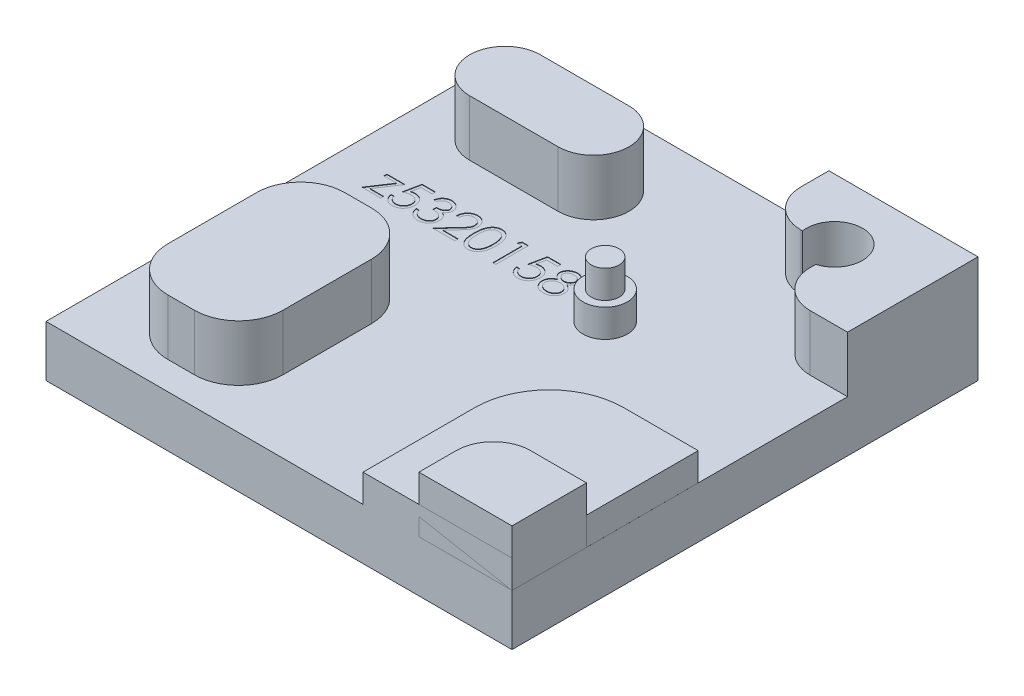
from build123d import *

# Parameters (mm, degrees)
SKETCH1_W            = 50
SKETCH1_H            = 50
BOSS_EXTRUDE4_DEPTH  = 5.5
BOSS_EXTRUDE27_DEPTH = 6
SKETCH10_R           = 2.375
BOSS_EXTRUDE29_DEPTH = 3
CUT_EXTRUDE1_DEPTH   = 0.05
BOSS_EXTRUDE31_DEPTH = 6
BOSS_EXTRUDE32_DEPTH = 6
BOSS_EXTRUDE38_DEPTH = 3
BOSS_EXTRUDE39_DEPTH = 6
SKETCH12_R           = 1.4985
BOSS_EXTRUDE40_DEPTH = 3


with BuildPart() as part:
    # Sketch1 → Boss-Extrude4 (new body)
    with BuildSketch(Plane(origin=(0, 0, 0), x_dir=(1, 0, 0), z_dir=(0, 1, 0))):
        with Locations((2.35426009, -4.035874439)):
            Rectangle(SKETCH1_W, SKETCH1_H)
    extrude(amount=BOSS_EXTRUDE4_DEPTH)

    # Sketch8 → Boss-Extrude27 (add)
    with BuildSketch(Plane(origin=(0, 5.5, 0), x_dir=(1, 0, 0), z_dir=(0, 1, 0))):
        with BuildLine():
            ThreePointArc((11.35426009, 17.964125561), (12.525832965, 15.135698436), (15.35426009, 13.964125561))
            Line((15.35426009, 13.964125561), (15.533330738, 13.964125561))
            ThreePointArc((15.533330738, 13.964125561), (20.09656079, 16.968446906), (19.35426009, 11.555683755))
            Line((19.35426009, 11.555683755), (19.35426009, 10.964125561))
            ThreePointArc((19.35426009, 10.964125561), (20.525832965, 8.135698436), (23.35426009, 6.964125561))
            Line((23.35426009, 6.964125561), (27.35426009, 6.964125561))
            Line((27.35426009, 6.964125561), (27.35426009, 20.964125561))
            Line((27.35426009, 20.964125561), (11.35426009, 20.964125561))
            Line((11.35426009, 20.964125561), (11.35426009, 17.964125561))
        make_face()
    extrude(amount=BOSS_EXTRUDE27_DEPTH)

    # Sketch13 → Cut-Extrude1 (cut)
    # profile 1 of 8: a face of its own
    with BuildSketch(Plane(origin=(0, 5.5, 0), x_dir=(1, 0, 0), z_dir=(0, 1, 0))):
        Polygon((-18.036064921, 2.940033073), (-16.106577742, 2.940033073), (-17.59435819, 0.696443329), (-16.151449537, 0.696443329), (-16.151449537, 0.382340765), (-18.170680306, 0.382340765), (-16.682198735, 2.625930509), (-18.036064921, 2.625930509), align=None)
    # profile 2 of 8: a face of its own
    with BuildSketch(Plane(origin=(0, 5.5, 0), x_dir=(1, 0, 0), z_dir=(0, 1, 0))):
        with BuildLine():
            Line((-13.773244408, 3.882340765), (-13.773244408, 3.523366406))
            Line((-13.773244408, 3.523366406), (-14.963749216, 3.523366406))
            Line((-14.963749216, 3.523366406), (-15.152350979, 2.60279349))
            add(Edge.make_bspline(
                [(-15.152350979, 2.60279349), (-15.115295104, 2.613023761), (-15.043505209, 2.632843295), (-14.937545348, 2.654849065), (-14.836953144, 2.66811451), (-14.771677774, 2.66992582), (-14.740091363, 2.670802304)],
                knots=[0, 0, 0, 0, 1.100273476, 2.13160584, 3.095893838, 4, 4, 4, 4], degree=3))
            add(Edge.make_bspline(
                [(-14.740091363, 2.670802304), (-14.701007624, 2.669956368), (-14.624159226, 2.668293047), (-14.511720279, 2.652321198), (-14.404387386, 2.627181283), (-14.302385016, 2.592060761), (-14.205524465, 2.547151028), (-14.114696904, 2.491051088), (-14.028538991, 2.425517757), (-13.948596397, 2.350172745), (-13.876072089, 2.267251128), (-13.812306099, 2.178093257), (-13.758143509, 2.083565595), (-13.714582754, 1.982764986), (-13.67979842, 1.876805833), (-13.656646425, 1.76457325), (-13.641229716, 1.64712513), (-13.63950733, 1.56682056), (-13.638629024, 1.525870413)],
                knots=[0, 0, 0, 0, 1.052922333, 2.070308379, 3.05430497, 4.020497103, 4.973039431, 5.925935799, 6.892292201, 7.88610001, 8.88166317, 9.857072816, 10.836096531, 11.812156883, 12.81219415, 13.836441305, 14.89672472, 16, 16, 16, 16], degree=3))
            add(Edge.make_bspline(
                [(-13.638629024, 1.525870413), (-13.639294099, 1.497348192), (-13.640615262, 1.440689205), (-13.647333849, 1.356545004), (-13.660269565, 1.274182171), (-13.677637289, 1.193589779), (-13.700179707, 1.114920407), (-13.727468761, 1.037948879), (-13.760864789, 0.963154272), (-13.797496164, 0.889828877), (-13.838742642, 0.81963037), (-13.884521149, 0.753981384), (-13.932886641, 0.691897102), (-13.984928026, 0.634043369), (-14.041129021, 0.580800351), (-14.100808988, 0.53185207), (-14.163491707, 0.486370739), (-14.230146949, 0.446202544), (-14.299289432, 0.409239588), (-14.37191765, 0.378916051), (-14.44637835, 0.351805523), (-14.523743226, 0.330195995), (-14.603837038, 0.31326344), (-14.686791814, 0.30176284), (-14.772172484, 0.293386402), (-14.830047496, 0.292862045), (-14.859282069, 0.292597176)],
                knots=[0, 0, 0, 0, 1.056347294, 2.098418968, 3.122841568, 4.141288669, 5.149314143, 6.15115421, 7.162517403, 8.180376062, 9.185164535, 10.17417709, 11.141909838, 12.097768115, 13.052685741, 14.0056014, 14.954263652, 15.917497458, 16.885230207, 17.854509472, 18.828990115, 19.81800267, 20.826176721, 21.857883937, 22.917946725, 24, 24, 24, 24], degree=3))
            add(Edge.make_bspline(
                [(-14.859282069, 0.292597176), (-14.894156249, 0.293288014), (-14.96276708, 0.294647156), (-15.063287647, 0.308865641), (-15.160002253, 0.329229557), (-15.252132354, 0.359865827), (-15.340503618, 0.398253122), (-15.423926335, 0.446769293), (-15.504532111, 0.501748397), (-15.579044148, 0.56662875), (-15.648200262, 0.637544432), (-15.710106771, 0.714502073), (-15.765240347, 0.796231515), (-15.812718094, 0.883129669), (-15.853216116, 0.9749682), (-15.885031104, 1.072091201), (-15.910709459, 1.173991205), (-15.921572879, 1.244144716), (-15.927090562, 1.279776663)],
                knots=[0, 0, 0, 0, 1.0467383, 2.05933395, 3.04377827, 4.011590433, 4.970194871, 5.932262533, 6.905835911, 7.896367577, 8.894135286, 9.877477877, 10.858688626, 11.851381753, 12.8477658, 13.868841284, 14.917554742, 16, 16, 16, 16], degree=3))
            Line((-15.927090562, 1.279776663), (-15.612987998, 1.279776663))
            add(Edge.make_bspline(
                [(-15.612987998, 1.279776663), (-15.605259441, 1.24640021), (-15.590404724, 1.182248815), (-15.557798975, 1.092117474), (-15.5179331, 1.01179825), (-15.470528752, 0.940228667), (-15.413978721, 0.87781967), (-15.349449292, 0.822202608), (-15.277101569, 0.772027479), (-15.196708339, 0.730204711), (-15.11189526, 0.694535958), (-15.02312805, 0.670784263), (-14.932823704, 0.65408337), (-14.871745333, 0.652411609), (-14.841052902, 0.651571535)],
                knots=[0, 0, 0, 0, 1.136247022, 2.183929868, 3.172523383, 4.106158343, 5.02341133, 5.958108904, 6.928429099, 7.938127109, 8.96079061, 9.975095812, 10.982467395, 12, 12, 12, 12], degree=3))
            add(Edge.make_bspline(
                [(-14.841052902, 0.651571535), (-14.811094458, 0.652392312), (-14.752106035, 0.654008431), (-14.665294649, 0.666447443), (-14.581481774, 0.685605014), (-14.501494418, 0.714274869), (-14.423932878, 0.749119588), (-14.350759108, 0.793834663), (-14.279856231, 0.845294682), (-14.213428097, 0.904251312), (-14.152588648, 0.969221007), (-14.098832527, 1.0386984), (-14.054055613, 1.112815247), (-14.016321504, 1.190288399), (-13.987668205, 1.271966957), (-13.967227224, 1.357468132), (-13.955224165, 1.447003112), (-13.953572985, 1.508072422), (-13.952731588, 1.539191727)],
                knots=[0, 0, 0, 0, 1.027316725, 2.022795036, 3.002884548, 3.971462791, 4.93288096, 5.914575861, 6.907176829, 7.935150275, 8.956128384, 9.956726525, 10.942570165, 11.921478529, 12.907843606, 13.90538589, 14.932640048, 16, 16, 16, 16], degree=3))
            add(Edge.make_bspline(
                [(-13.952731588, 1.539191727), (-13.953390067, 1.567267478), (-13.954678947, 1.622221767), (-13.965209517, 1.702620974), (-13.98352649, 1.778694016), (-14.00895037, 1.85080825), (-14.041229877, 1.919031693), (-14.08067619, 1.983434753), (-14.128029588, 2.043168586), (-14.182121476, 2.09826114), (-14.241379517, 2.149106014), (-14.30682326, 2.192450101), (-14.377083187, 2.228914019), (-14.451312786, 2.260382017), (-14.531277685, 2.282982762), (-14.615394317, 2.299950648), (-14.704571025, 2.30976601), (-14.765541713, 2.311127899), (-14.796882229, 2.311827945)],
                knots=[0, 0, 0, 0, 1.045622112, 2.046656509, 3.013763289, 3.955457236, 4.890082067, 5.820317437, 6.762574623, 7.722996705, 8.69280354, 9.665887285, 10.63943826, 11.638615906, 12.663482002, 13.728887084, 14.832589034, 16, 16, 16, 16], degree=3))
            add(Edge.make_bspline(
                [(-14.796882229, 2.311827945), (-14.824011158, 2.311247354), (-14.880025513, 2.31004858), (-14.96594834, 2.301222083), (-15.056240063, 2.286982789), (-15.150554558, 2.267396541), (-15.249175066, 2.241765465), (-15.351893467, 2.211050964), (-15.458925734, 2.174328965), (-15.531043458, 2.146596752), (-15.568116203, 2.132340765)],
                knots=[0, 0, 0, 0, 0.817624296, 1.688186739, 2.600797293, 3.572016777, 4.590301741, 5.671205678, 6.80286297, 8, 8, 8, 8], degree=3))
            Line((-15.568116203, 2.132340765), (-15.209141844, 3.882340765))
            Line((-15.209141844, 3.882340765), (-13.773244408, 3.882340765))
        make_face()
    # profile 3 of 8: a face of its own
    with BuildSketch(Plane(origin=(0, 5.5, 0), x_dir=(1, 0, 0), z_dir=(0, 1, 0))):
        with BuildLine():
            Line((-12.830936716, 3.074648458), (-13.14503928, 3.074648458))
            add(Edge.make_bspline(
                [(-13.14503928, 3.074648458), (-13.136529729, 3.109880942), (-13.119894254, 3.178757566), (-13.08519668, 3.277164827), (-13.047397425, 3.370288348), (-13.002008321, 3.456384422), (-12.952499566, 3.537183325), (-12.895776845, 3.610852449), (-12.834457122, 3.679265415), (-12.766632173, 3.739978652), (-12.695503511, 3.794956381), (-12.620068892, 3.841831439), (-12.541845998, 3.882155592), (-12.460292865, 3.915375823), (-12.375166693, 3.940401347), (-12.28723707, 3.958558153), (-12.19627357, 3.970349267), (-12.134525979, 3.97150003), (-12.103172293, 3.972084355)],
                knots=[0, 0, 0, 0, 1.162005537, 2.271625781, 3.343758855, 4.383309926, 5.390229558, 6.379919256, 7.361854164, 8.333198761, 9.295911338, 10.242430842, 11.177959212, 12.116337295, 13.062827104, 14.020064771, 14.994644689, 16, 16, 16, 16], degree=3))
            add(Edge.make_bspline(
                [(-12.103172293, 3.972084355), (-12.057489551, 3.970705125), (-11.96712054, 3.967976749), (-11.834357493, 3.943062313), (-11.706330674, 3.90363718), (-11.584441426, 3.849163453), (-11.471222993, 3.78197614), (-11.370486807, 3.702011403), (-11.283598296, 3.610812102), (-11.210703918, 3.510079537), (-11.153628919, 3.402424028), (-11.111542546, 3.291623871), (-11.085920865, 3.1779419), (-11.082600308, 3.10118462), (-11.080936716, 3.062729387)],
                knots=[0, 0, 0, 0, 1.083050992, 2.142477498, 3.193116406, 4.255571735, 5.30263384, 6.308962982, 7.297363603, 8.282367274, 9.249857812, 10.179914175, 11.08814088, 12, 12, 12, 12], degree=3))
            add(Edge.make_bspline(
                [(-11.080936716, 3.062729387), (-11.082100307, 3.025722592), (-11.084377274, 2.953306038), (-11.10371098, 2.847584541), (-11.136247243, 2.74794294), (-11.181317005, 2.653961778), (-11.239658555, 2.566236939), (-11.310331252, 2.484571048), (-11.393833914, 2.40860189), (-11.457112852, 2.365082417), (-11.489690722, 2.342677304)],
                knots=[0, 0, 0, 0, 1.024540389, 2.004866551, 2.965041327, 3.920577974, 4.882998113, 5.874504559, 6.905732034, 8, 8, 8, 8], degree=3))
            add(Edge.make_bspline(
                [(-11.489690722, 2.342677304), (-11.452458968, 2.324699132), (-11.378692094, 2.289079175), (-11.278141564, 2.219223417), (-11.186863689, 2.13856707), (-11.13595997, 2.075624417), (-11.110383831, 2.043999419)],
                knots=[0, 0, 0, 0, 1.015518401, 2.012035669, 3.001164323, 4, 4, 4, 4], degree=3))
            add(Edge.make_bspline(
                [(-11.110383831, 2.043999419), (-11.093542489, 2.020941668), (-11.060135593, 1.975203751), (-11.018900059, 1.901667325), (-10.981490945, 1.827315836), (-10.952340726, 1.75015643), (-10.929766859, 1.671083416), (-10.913630827, 1.58996102), (-10.903606686, 1.506722998), (-10.902171134, 1.450410517), (-10.901449537, 1.422104387)],
                knots=[0, 0, 0, 0, 1.025084078, 2.033381695, 3.024893161, 4.013698104, 4.991890475, 5.976764909, 6.982997093, 8, 8, 8, 8], degree=3))
            add(Edge.make_bspline(
                [(-10.901449537, 1.422104387), (-10.90324405, 1.373094666), (-10.906824632, 1.275305864), (-10.938828706, 1.130831142), (-10.988441947, 0.98960564), (-11.058898883, 0.854530801), (-11.144766392, 0.72815042), (-11.246923716, 0.615074111), (-11.364210124, 0.517875507), (-11.495015773, 0.436665278), (-11.636732902, 0.371747356), (-11.788308494, 0.326689913), (-11.947558548, 0.297343914), (-12.056765845, 0.294197045), (-12.112286876, 0.292597176)],
                knots=[0, 0, 0, 0, 0.955779014, 1.907060117, 2.875433937, 3.871313158, 4.872415639, 5.851225146, 6.836215519, 7.83643374, 8.849228613, 9.86973379, 10.916971861, 12, 12, 12, 12], degree=3))
            add(Edge.make_bspline(
                [(-12.112286876, 0.292597176), (-12.149706177, 0.293465389), (-12.223334882, 0.295173743), (-12.33157838, 0.306852344), (-12.434900079, 0.328182349), (-12.533439677, 0.356885655), (-12.627284714, 0.393277397), (-12.716148819, 0.438596095), (-12.800578712, 0.491907597), (-12.879777663, 0.553841185), (-12.953736231, 0.623122524), (-13.020488955, 0.700981534), (-13.081148748, 0.785978938), (-13.134091387, 0.879101995), (-13.18172834, 0.979147252), (-13.220909296, 1.08739575), (-13.255394865, 1.202879772), (-13.271428329, 1.283357512), (-13.279654665, 1.324648458)],
                knots=[0, 0, 0, 0, 1.048658725, 2.063410685, 3.046034179, 4.001477787, 4.936774919, 5.862367409, 6.792675028, 7.730719943, 8.675894397, 9.627829632, 10.600096036, 11.597688215, 12.626045268, 13.701542398, 14.82072376, 16, 16, 16, 16], degree=3))
            Line((-13.279654665, 1.324648458), (-12.965552101, 1.324648458))
            add(Edge.make_bspline(
                [(-12.965552101, 1.324648458), (-12.957368809, 1.297699444), (-12.941451597, 1.245281273), (-12.914357299, 1.169840967), (-12.883489026, 1.100682914), (-12.850374468, 1.037299792), (-12.815596022, 0.979067389), (-12.776681097, 0.92752552), (-12.736511951, 0.880410318), (-12.706232598, 0.853865706), (-12.691413479, 0.840874419)],
                knots=[0, 0, 0, 0, 1.198163088, 2.33053128, 3.407730985, 4.417276592, 5.372219308, 6.28897303, 7.162600585, 8, 8, 8, 8], degree=3))
            add(Edge.make_bspline(
                [(-12.691413479, 0.840874419), (-12.671816902, 0.825766085), (-12.632684239, 0.795596053), (-12.568916008, 0.757094425), (-12.501851122, 0.7237334), (-12.430036448, 0.698249704), (-12.355021678, 0.676672043), (-12.275594312, 0.662551524), (-12.192455095, 0.652863353), (-12.135687332, 0.652008421), (-12.106677902, 0.651571535)],
                knots=[0, 0, 0, 0, 0.946170439, 1.889420265, 2.845303464, 3.807233317, 4.801018734, 5.828864929, 6.890507805, 8, 8, 8, 8], degree=3))
            add(Edge.make_bspline(
                [(-12.106677902, 0.651571535), (-12.073924399, 0.65218744), (-12.009877752, 0.653391789), (-11.916422893, 0.664467496), (-11.827515445, 0.68059791), (-11.74414252, 0.705510892), (-11.665212012, 0.736291744), (-11.591830363, 0.774940149), (-11.523034257, 0.820284871), (-11.459704851, 0.87182403), (-11.402759344, 0.928245525), (-11.35261983, 0.987258596), (-11.309995169, 1.048614425), (-11.275611591, 1.112652546), (-11.24846104, 1.179107775), (-11.22997784, 1.248166604), (-11.217126325, 1.319263871), (-11.216079713, 1.36759284), (-11.215552101, 1.39195615)],
                knots=[0, 0, 0, 0, 1.217147791, 2.380027433, 3.494444702, 4.572153297, 5.609568379, 6.639424714, 7.649109417, 8.668170816, 9.669597737, 10.625200337, 11.543417969, 12.441394052, 13.322311151, 14.205496177, 15.095365482, 16, 16, 16, 16], degree=3))
            add(Edge.make_bspline(
                [(-11.215552101, 1.39195615), (-11.217082402, 1.424567489), (-11.220135391, 1.489627897), (-11.24344397, 1.585345471), (-11.281782834, 1.677568884), (-11.335455346, 1.764724674), (-11.400791074, 1.845500575), (-11.477155981, 1.917572058), (-11.565184209, 1.977042149), (-11.646204079, 2.018130805), (-11.717969235, 2.04616788), (-11.779384619, 2.064842845), (-11.848141223, 2.080656501), (-11.923407572, 2.095368772), (-12.005750788, 2.10789012), (-12.095081226, 2.118331936), (-12.191416988, 2.126686977), (-12.258108154, 2.130418072), (-12.292475178, 2.132340765)],
                knots=[0, 0, 0, 0, 1.07054697, 2.135767047, 3.216561865, 4.33974944, 5.486079747, 6.621378074, 7.775625952, 8.963672916, 9.598146892, 10.304877434, 11.070270905, 11.915000392, 12.823868403, 13.805723172, 14.86925407, 16, 16, 16, 16], degree=3))
            Line((-12.292475178, 2.132340765), (-12.292475178, 2.491315124))
            add(Edge.make_bspline(
                [(-12.292475178, 2.491315124), (-12.249174012, 2.492049928), (-12.164357665, 2.493489228), (-12.040463361, 2.510897238), (-11.921990048, 2.534977866), (-11.811563306, 2.571863059), (-11.710914593, 2.614703356), (-11.623594991, 2.664555565), (-11.550827844, 2.719970314), (-11.492966772, 2.781802924), (-11.449437544, 2.848117971), (-11.417610746, 2.917234629), (-11.39881042, 2.98975869), (-11.396300753, 3.039253358), (-11.39503928, 3.064131631)],
                knots=[0, 0, 0, 0, 1.321986639, 2.589447074, 3.816329219, 5.01088745, 6.139805852, 7.153945165, 8.075214402, 8.924034688, 9.728124013, 10.488707548, 11.240355623, 12, 12, 12, 12], degree=3))
            add(Edge.make_bspline(
                [(-11.39503928, 3.064131631), (-11.395453691, 3.082409376), (-11.396278142, 3.118772083), (-11.40667542, 3.171897152), (-11.422299461, 3.223398098), (-11.44377919, 3.273055908), (-11.472529389, 3.320526182), (-11.506935375, 3.366213631), (-11.547903476, 3.40985741), (-11.594848923, 3.450537729), (-11.645260728, 3.489306966), (-11.700510503, 3.522220603), (-11.758932377, 3.550365665), (-11.820591032, 3.573575167), (-11.885686563, 3.591034456), (-11.95391312, 3.603570297), (-12.025400804, 3.611407952), (-12.074172536, 3.612536368), (-12.098965562, 3.613109996)],
                knots=[0, 0, 0, 0, 0.884392785, 1.759457502, 2.611959086, 3.489218968, 4.37281399, 5.2945488, 6.255912374, 7.266815255, 8.301784654, 9.332968512, 10.37626691, 11.440494194, 12.520033166, 13.637162961, 14.798855837, 16, 16, 16, 16], degree=3))
            add(Edge.make_bspline(
                [(-12.098965562, 3.613109996), (-12.13881723, 3.611718634), (-12.216656807, 3.60900098), (-12.328871723, 3.585197967), (-12.433191057, 3.547219883), (-12.512929724, 3.501886864), (-12.571812298, 3.45713643), (-12.613889236, 3.418054044), (-12.655209747, 3.37462122), (-12.693055424, 3.324162845), (-12.7313294, 3.270096055), (-12.766173962, 3.209672373), (-12.800033654, 3.144467979), (-12.820436204, 3.098372344), (-12.830936716, 3.074648458)],
                knots=[0, 0, 0, 0, 1.472543308, 2.876219568, 4.221790263, 5.565193594, 6.249813518, 6.953379497, 7.687249741, 8.463570142, 9.283606569, 10.136032583, 11.040678096, 12, 12, 12, 12], degree=3))
        make_face()
    # profile 4 of 8: a face of its own
    with BuildSketch(Plane(origin=(0, 5.5, 0), x_dir=(1, 0, 0), z_dir=(0, 1, 0))):
        with BuildLine():
            Line((-10.138629024, 2.805417688), (-10.452731588, 2.805417688))
            add(Edge.make_bspline(
                [(-10.452731588, 2.805417688), (-10.450684435, 2.847088576), (-10.446663881, 2.928929091), (-10.427835592, 3.048252997), (-10.400894714, 3.162307796), (-10.36280326, 3.27017771), (-10.315496983, 3.372816517), (-10.258766955, 3.469816533), (-10.191573105, 3.560807721), (-10.115366371, 3.644946565), (-10.032597732, 3.722134136), (-9.943291792, 3.788789378), (-9.849446765, 3.84510705), (-9.751347366, 3.892188292), (-9.647886802, 3.927528137), (-9.540003944, 3.953749777), (-9.427224808, 3.969526123), (-9.350384786, 3.971221908), (-9.311305306, 3.972084355)],
                knots=[0, 0, 0, 0, 1.10065271, 2.161652631, 3.183658789, 4.190468796, 5.17591951, 6.163126047, 7.15150782, 8.156236427, 9.156009102, 10.134482811, 11.092018607, 12.041330605, 13.001268258, 13.972401359, 14.968799086, 16, 16, 16, 16], degree=3))
            add(Edge.make_bspline(
                [(-9.311305306, 3.972084355), (-9.272927232, 3.971185899), (-9.197515687, 3.969420464), (-9.087453673, 3.954259434), (-8.982676378, 3.930513843), (-8.883388612, 3.897198427), (-8.790382547, 3.852413999), (-8.702959502, 3.79861646), (-8.620078692, 3.736396629), (-8.545471908, 3.663142816), (-8.476963829, 3.584940431), (-8.417861574, 3.501452528), (-8.36724841, 3.415223242), (-8.32506073, 3.32559504), (-8.294004591, 3.231724012), (-8.270426383, 3.134976809), (-8.25709897, 3.034351998), (-8.255053546, 2.966245442), (-8.254013639, 2.931619611)],
                knots=[0, 0, 0, 0, 1.111607364, 2.184268762, 3.212621178, 4.221274766, 5.211760367, 6.196651075, 7.1921475, 8.207485113, 9.220403448, 10.201281604, 11.166441695, 12.114753415, 13.065576456, 14.026450734, 14.996634279, 16, 16, 16, 16], degree=3))
            add(Edge.make_bspline(
                [(-8.254013639, 2.931619611), (-8.255706902, 2.882871777), (-8.259063713, 2.786231563), (-8.28777809, 2.6442167), (-8.332624601, 2.506623281), (-8.386621958, 2.395885979), (-8.441094402, 2.306652486), (-8.490181909, 2.233183781), (-8.54764672, 2.154078312), (-8.614325218, 2.069600975), (-8.688838091, 1.97909007), (-8.771860254, 1.882600274), (-8.863983736, 1.781128505), (-8.928642237, 1.711822903), (-8.962146652, 1.675910477)],
                knots=[0, 0, 0, 0, 1.184426356, 2.348067706, 3.509069118, 4.696110526, 5.333549288, 6.050745305, 6.844228056, 7.710549037, 8.667450064, 9.695053472, 10.805634456, 12, 12, 12, 12], degree=3))
            Line((-8.962146652, 1.675910477), (-9.837847774, 0.741315124))
            Line((-9.837847774, 0.741315124), (-8.209141844, 0.741315124))
            Line((-8.209141844, 0.741315124), (-8.209141844, 0.382340765))
            Line((-8.209141844, 0.382340765), (-10.587346972, 0.382340765))
            Line((-10.587346972, 0.382340765), (-9.229975178, 1.830858393))
            add(Edge.make_bspline(
                [(-9.229975178, 1.830858393), (-9.196927291, 1.8653567), (-9.133449064, 1.931620887), (-9.043666487, 2.028363847), (-8.963027499, 2.118113388), (-8.891010106, 2.200699936), (-8.8291766, 2.277331504), (-8.774304368, 2.345526207), (-8.730338777, 2.408280658), (-8.682623382, 2.481021272), (-8.6364094, 2.569833589), (-8.596697044, 2.678367278), (-8.572482196, 2.790094531), (-8.56957736, 2.865596568), (-8.568116203, 2.90357474)],
                knots=[0, 0, 0, 0, 1.329631726, 2.553950428, 3.673215718, 4.687767853, 5.603093632, 6.413772471, 7.123043292, 7.734684054, 8.834405432, 9.900288307, 10.943827018, 12, 12, 12, 12], degree=3))
            add(Edge.make_bspline(
                [(-8.568116203, 2.90357474), (-8.568751946, 2.927456138), (-8.570004871, 2.974521788), (-8.581062569, 3.043527547), (-8.597773075, 3.110092361), (-8.621718333, 3.17442098), (-8.653325073, 3.235866632), (-8.691798453, 3.294504113), (-8.736188517, 3.351193078), (-8.787539786, 3.404346376), (-8.843951306, 3.453027581), (-8.903545555, 3.496151667), (-8.96659566, 3.532190778), (-9.032835782, 3.561734275), (-9.102081251, 3.584909656), (-9.174465996, 3.600968235), (-9.249790013, 3.611050719), (-9.301223508, 3.612414891), (-9.327431107, 3.613109996)],
                knots=[0, 0, 0, 0, 0.991446411, 1.95395049, 2.89581595, 3.838931463, 4.798493298, 5.75982156, 6.748411868, 7.785213223, 8.824556874, 9.840280684, 10.836137867, 11.835679398, 12.848801643, 13.863922112, 14.911575587, 16, 16, 16, 16], degree=3))
            add(Edge.make_bspline(
                [(-9.327431107, 3.613109996), (-9.35480194, 3.612394964), (-9.408553736, 3.610990758), (-9.487472769, 3.601168094), (-9.562758546, 3.584222254), (-9.634600449, 3.56104558), (-9.703120035, 3.531587031), (-9.767984079, 3.494895286), (-9.829046969, 3.451111793), (-9.886423492, 3.401471237), (-9.939287471, 3.346203636), (-9.985734347, 3.284593672), (-10.026318361, 3.217766257), (-10.061727594, 3.145901706), (-10.090483285, 3.068347927), (-10.112456435, 2.985380222), (-10.129843282, 2.89735884), (-10.135651802, 2.836573755), (-10.138629024, 2.805417688)],
                knots=[0, 0, 0, 0, 1.031018746, 2.02475058, 2.990194455, 3.934040569, 4.864654155, 5.795059489, 6.735614925, 7.690564532, 8.649604399, 9.611025574, 10.590972636, 11.591080095, 12.624614302, 13.701020113, 14.821632451, 16, 16, 16, 16], degree=3))
        make_face()
    # profile 5 of 8: a face of its own
    with BuildSketch(Plane(origin=(0, 5.5, 0), x_dir=(1, 0, 0), z_dir=(0, 1, 0))):
        with BuildLine():
            add(Edge.make_bspline(
                [(-7.89503928, 2.130938522), (-7.894711262, 2.187035909), (-7.894074082, 2.296005894), (-7.886985661, 2.454790536), (-7.875210319, 2.603750825), (-7.859072946, 2.742893891), (-7.839434966, 2.872255655), (-7.813219479, 2.991490412), (-7.783406676, 3.101150019), (-7.748854231, 3.201592068), (-7.709866442, 3.294169771), (-7.667432181, 3.380594972), (-7.619867386, 3.460736904), (-7.569890474, 3.535874695), (-7.515478402, 3.604778389), (-7.458179611, 3.668421052), (-7.395757735, 3.725331802), (-7.330334727, 3.777178105), (-7.261318263, 3.822627576), (-7.190675596, 3.862660315), (-7.117920491, 3.896860182), (-7.042854308, 3.923750618), (-6.96615175, 3.945961465), (-6.887544683, 3.961150413), (-6.806903319, 3.970707321), (-6.752471884, 3.971620989), (-6.724867004, 3.972084355)],
                knots=[0, 0, 0, 0, 1.646270934, 3.197905019, 4.663502075, 6.030701355, 7.308322542, 8.50163776, 9.611534131, 10.641858119, 11.616356847, 12.558055219, 13.465016945, 14.349605745, 15.204443733, 16.039544428, 16.859896111, 17.680448484, 18.487036065, 19.28249412, 20.06191084, 20.843045899, 21.620316918, 22.403196591, 23.190181807, 24, 24, 24, 24], degree=3))
            add(Edge.make_bspline(
                [(-6.724867004, 3.972084355), (-6.697031526, 3.97159654), (-6.641675517, 3.970626429), (-6.559835142, 3.961302486), (-6.47988546, 3.945831363), (-6.402167321, 3.923910389), (-6.326042335, 3.896714712), (-6.252105927, 3.862627595), (-6.179898846, 3.822948728), (-6.110568558, 3.77632485), (-6.043353943, 3.724342574), (-5.97990598, 3.665579905), (-5.920218894, 3.600630186), (-5.863543589, 3.530188322), (-5.811487991, 3.452903237), (-5.761914559, 3.370119127), (-5.717542523, 3.280388263), (-5.674807848, 3.185207795), (-5.637920861, 3.081944136), (-5.604654616, 2.971179376), (-5.577775647, 2.851605189), (-5.555386375, 2.723848943), (-5.538041479, 2.58744146), (-5.525408837, 2.442675145), (-5.518735752, 2.289454754), (-5.517479051, 2.184696905), (-5.516834152, 2.130938522)],
                knots=[0, 0, 0, 0, 0.810914788, 1.612654377, 2.396697861, 3.181598691, 3.963628158, 4.749916497, 5.551656086, 6.361998678, 7.18212741, 8.025565596, 8.878627764, 9.750805457, 10.657531673, 11.591944965, 12.560506719, 13.57287815, 14.630710178, 15.753379473, 16.941251878, 18.199788006, 19.531962791, 20.947069417, 22.433333509, 24, 24, 24, 24], degree=3))
            add(Edge.make_bspline(
                [(-5.516834152, 2.130938522), (-5.517485736, 2.077414614), (-5.518755322, 1.973125462), (-5.525334029, 1.820594487), (-5.53829266, 1.676596443), (-5.554502649, 1.540785981), (-5.576953612, 1.413728362), (-5.604558778, 1.294983914), (-5.635209101, 1.184039842), (-5.673043895, 1.08180503), (-5.714454605, 0.986853307), (-5.759509801, 0.898186159), (-5.807779627, 0.815019866), (-5.860368372, 0.738020119), (-5.916421786, 0.666641462), (-5.977139574, 0.60214384), (-6.040810159, 0.542973168), (-6.108222575, 0.49032154), (-6.178634127, 0.444236736), (-6.250593203, 0.403022885), (-6.325376587, 0.36979019), (-6.40128954, 0.341255149), (-6.479417906, 0.319454697), (-6.559664296, 0.304380842), (-6.641620532, 0.293808993), (-6.697022097, 0.293002513), (-6.724867004, 0.292597176)],
                knots=[0, 0, 0, 0, 1.561518951, 3.042555995, 4.452378317, 5.7783523, 7.031515105, 8.214008947, 9.334062868, 10.386615937, 11.391082383, 12.354592575, 13.286541444, 14.194233754, 15.072674879, 15.931287219, 16.775624067, 17.606195743, 18.42308326, 19.229000347, 20.022332153, 20.807536673, 21.593273796, 22.3848459, 23.188221202, 24, 24, 24, 24], degree=3))
            add(Edge.make_bspline(
                [(-6.724867004, 0.292597176), (-6.752471118, 0.293063531), (-6.806901043, 0.293983093), (-6.887553469, 0.303496824), (-6.965835912, 0.318792328), (-7.042134666, 0.340208932), (-7.116841181, 0.366423768), (-7.188937468, 0.400577452), (-7.259225152, 0.439911521), (-7.327516708, 0.484706942), (-7.392528869, 0.536028625), (-7.454627474, 0.592792914), (-7.512252493, 0.656416325), (-7.565886589, 0.725894248), (-7.616860677, 0.800587491), (-7.66375005, 0.881515864), (-7.707120904, 0.968358474), (-7.746764395, 1.061676385), (-7.781913058, 1.162831313), (-7.812960767, 1.272980491), (-7.837474924, 1.393096127), (-7.858457879, 1.522213494), (-7.875382262, 1.660887425), (-7.886936588, 1.809193203), (-7.894077903, 1.967038412), (-7.894712973, 2.075308186), (-7.89503928, 2.130938522)],
                knots=[0, 0, 0, 0, 0.810891512, 1.598919785, 2.382837074, 3.152667961, 3.926044502, 4.706494248, 5.493654104, 6.291793342, 7.103789334, 7.925228297, 8.761435821, 9.622817696, 10.50288917, 11.416980706, 12.369136599, 13.353924996, 14.394355917, 15.514179734, 16.714354668, 17.994756427, 19.357759367, 20.818452758, 22.365282078, 24, 24, 24, 24], degree=3))
        make_face()
        with BuildLine():
            add(Edge.make_bspline(
                [(-7.580936716, 2.132340765), (-7.580817269, 2.085592066), (-7.580585446, 1.994862022), (-7.574529245, 1.863018761), (-7.566279013, 1.740048432), (-7.555637716, 1.625794895), (-7.539834767, 1.520644883), (-7.52212798, 1.4238752), (-7.50057989, 1.335997963), (-7.475084872, 1.256410152), (-7.446045775, 1.183761084), (-7.414339912, 1.116159868), (-7.380279189, 1.052807932), (-7.342160038, 0.994274324), (-7.300644975, 0.94036816), (-7.256671716, 0.890135327), (-7.208599131, 0.845338346), (-7.142095389, 0.791611491), (-7.054298914, 0.736092357), (-6.943678459, 0.687746267), (-6.830010008, 0.657363811), (-6.752858758, 0.653500055), (-6.714350178, 0.651571535)],
                knots=[0, 0, 0, 0, 1.459021318, 2.831673884, 4.118529203, 5.306027144, 6.411944654, 7.436330062, 8.375795394, 9.233974572, 10.042671642, 10.816086306, 11.563610507, 12.285937304, 12.993564865, 13.685989202, 14.367179055, 15.041617293, 16.353048772, 17.594441528, 18.799311195, 20, 20, 20, 20], degree=3))
            add(Edge.make_bspline(
                [(-6.714350178, 0.651571535), (-6.675592506, 0.653169315), (-6.598157183, 0.656361578), (-6.485023388, 0.687160315), (-6.375193117, 0.733629855), (-6.289121177, 0.78857736), (-6.223638634, 0.84090569), (-6.176721644, 0.885520338), (-6.133659595, 0.935476205), (-6.09281752, 0.989375501), (-6.055358445, 1.048247986), (-6.021295307, 1.111810561), (-5.990211959, 1.180239739), (-5.972502913, 1.228009478), (-5.963448735, 1.252432913)],
                knots=[0, 0, 0, 0, 1.353760809, 2.704726607, 4.075137775, 5.516104923, 6.260822281, 7.007110065, 7.778089737, 8.566572457, 9.372053459, 10.217411131, 11.088608312, 12, 12, 12, 12], degree=3))
            add(Edge.make_bspline(
                [(-5.963448735, 1.252432913), (-5.952896967, 1.283662652), (-5.931472354, 1.347072416), (-5.903860579, 1.445436068), (-5.88211518, 1.548638832), (-5.862551814, 1.656063949), (-5.849198759, 1.76850365), (-5.838450945, 1.885610034), (-5.832120258, 2.007471396), (-5.831335507, 2.090266388), (-5.830936716, 2.132340765)],
                knots=[0, 0, 0, 0, 0.884706709, 1.796334032, 2.740027952, 3.714592787, 4.726048262, 5.777819803, 6.87074269, 8, 8, 8, 8], degree=3))
            add(Edge.make_bspline(
                [(-5.830936716, 2.132340765), (-5.831486905, 2.174408338), (-5.832563193, 2.256701503), (-5.836677181, 2.377219683), (-5.847300755, 2.491687444), (-5.859099874, 2.600597917), (-5.876497095, 2.70334822), (-5.895254902, 2.800798525), (-5.920456114, 2.89174155), (-5.947375889, 2.977601131), (-5.978186285, 3.057401786), (-6.012102019, 3.131515572), (-6.048323778, 3.200300297), (-6.087666018, 3.263567238), (-6.129661701, 3.321599781), (-6.175419251, 3.373234376), (-6.223123623, 3.420071344), (-6.289940809, 3.473533913), (-6.377415099, 3.528045609), (-6.486260746, 3.578211369), (-6.599531391, 3.607019661), (-6.676104845, 3.611081348), (-6.714350178, 3.613109996)],
                knots=[0, 0, 0, 0, 1.31362396, 2.569729283, 3.763502607, 4.902122613, 5.988968491, 7.01645872, 7.998833611, 8.933434873, 9.825090667, 10.667526885, 11.477055099, 12.250526234, 12.991942729, 13.710640831, 14.402115721, 15.076753259, 16.378508321, 17.609869233, 18.806226677, 20, 20, 20, 20], degree=3))
            add(Edge.make_bspline(
                [(-6.714350178, 3.613109996), (-6.75306077, 3.611078549), (-6.830552475, 3.607011955), (-6.94500043, 3.578318702), (-7.054704782, 3.528305736), (-7.141947756, 3.473353363), (-7.208811543, 3.421015052), (-7.255894236, 3.375628598), (-7.300040408, 3.325982343), (-7.340708109, 3.271580429), (-7.378797392, 3.213115061), (-7.413778404, 3.150126297), (-7.445295734, 3.082294932), (-7.47438027, 3.009678497), (-7.499953058, 2.930097552), (-7.521047021, 2.842328559), (-7.540534075, 2.745866667), (-7.554329343, 2.640147159), (-7.566593099, 2.525865006), (-7.574474447, 2.402587688), (-7.580605705, 2.270523307), (-7.580824169, 2.179324149), (-7.580936716, 2.132340765)],
                knots=[0, 0, 0, 0, 1.207732386, 2.417664972, 3.655092373, 4.956220595, 5.625982001, 6.301752483, 6.994047911, 7.697131622, 8.419323945, 9.170223765, 9.943494443, 10.752040957, 11.610060368, 12.549350801, 13.567764191, 14.679664412, 15.874934091, 17.154273443, 18.533957287, 20, 20, 20, 20], degree=3))
        make_face(mode=Mode.SUBTRACT)
    # profile 6 of 8: a face of its own
    with BuildSketch(Plane(origin=(0, 5.5, 0), x_dir=(1, 0, 0), z_dir=(0, 1, 0))):
        Polygon((-4.458841363, 3.882340765), (-3.811705947, 3.882340765), (-3.811705947, 0.382340765), (-4.125808511, 0.382340765), (-4.125808511, 3.523366406), (-4.664270049, 3.523366406), align=None)
    # profile 7 of 8: a face of its own
    with BuildSketch(Plane(origin=(0, 5.5, 0), x_dir=(1, 0, 0), z_dir=(0, 1, 0))):
        with BuildLine():
            Line((-0.311705947, 3.882340765), (-0.311705947, 3.523366406))
            Line((-0.311705947, 3.523366406), (-1.502210754, 3.523366406))
            Line((-1.502210754, 3.523366406), (-1.690812517, 2.60279349))
            add(Edge.make_bspline(
                [(-1.690812517, 2.60279349), (-1.653756643, 2.613023761), (-1.581966747, 2.632843295), (-1.476006886, 2.654849065), (-1.375414683, 2.66811451), (-1.310139312, 2.66992582), (-1.278552902, 2.670802304)],
                knots=[0, 0, 0, 0, 1.100273476, 2.13160584, 3.095893838, 4, 4, 4, 4], degree=3))
            add(Edge.make_bspline(
                [(-1.278552902, 2.670802304), (-1.239469162, 2.669956368), (-1.162620765, 2.668293047), (-1.050181818, 2.652321198), (-0.942848925, 2.627181283), (-0.840846555, 2.592060761), (-0.743986004, 2.547151028), (-0.653158442, 2.491051088), (-0.567000529, 2.425517757), (-0.487057935, 2.350172745), (-0.414533627, 2.267251128), (-0.350767638, 2.178093257), (-0.296605047, 2.083565595), (-0.253044292, 1.982764986), (-0.218259958, 1.876805833), (-0.195107963, 1.76457325), (-0.179691254, 1.64712513), (-0.177968868, 1.56682056), (-0.177090562, 1.525870413)],
                knots=[0, 0, 0, 0, 1.052922333, 2.070308379, 3.05430497, 4.020497103, 4.973039431, 5.925935799, 6.892292201, 7.88610001, 8.88166317, 9.857072816, 10.836096531, 11.812156883, 12.81219415, 13.836441305, 14.89672472, 16, 16, 16, 16], degree=3))
            add(Edge.make_bspline(
                [(-0.177090562, 1.525870413), (-0.177755637, 1.497348192), (-0.1790768, 1.440689205), (-0.185795388, 1.356545004), (-0.198731104, 1.274182171), (-0.216098828, 1.193589779), (-0.238641246, 1.114920407), (-0.2659303, 1.037948879), (-0.299326327, 0.963154272), (-0.335957703, 0.889828877), (-0.377204181, 0.81963037), (-0.422982688, 0.753981384), (-0.471348179, 0.691897102), (-0.523389565, 0.634043369), (-0.57959056, 0.580800351), (-0.639270527, 0.53185207), (-0.701953246, 0.486370739), (-0.768608488, 0.446202544), (-0.837750971, 0.409239588), (-0.910379188, 0.378916051), (-0.984839888, 0.351805523), (-1.062204764, 0.330195995), (-1.142298577, 0.31326344), (-1.225253352, 0.30176284), (-1.310634022, 0.293386402), (-1.368509035, 0.292862045), (-1.397743607, 0.292597176)],
                knots=[0, 0, 0, 0, 1.056347294, 2.098418968, 3.122841568, 4.141288669, 5.149314143, 6.15115421, 7.162517403, 8.180376062, 9.185164535, 10.17417709, 11.141909838, 12.097768115, 13.052685741, 14.0056014, 14.954263652, 15.917497458, 16.885230207, 17.854509472, 18.828990115, 19.81800267, 20.826176721, 21.857883937, 22.917946725, 24, 24, 24, 24], degree=3))
            add(Edge.make_bspline(
                [(-1.397743607, 0.292597176), (-1.432617788, 0.293288014), (-1.501228618, 0.294647156), (-1.601749186, 0.308865641), (-1.698463791, 0.329229557), (-1.790593892, 0.359865827), (-1.878965156, 0.398253122), (-1.962387874, 0.446769293), (-2.04299365, 0.501748397), (-2.117505687, 0.56662875), (-2.1866618, 0.637544432), (-2.248568309, 0.714502073), (-2.303701886, 0.796231515), (-2.351179633, 0.883129669), (-2.391677654, 0.9749682), (-2.423492642, 1.072091201), (-2.449170997, 1.173991205), (-2.460034418, 1.244144716), (-2.465552101, 1.279776663)],
                knots=[0, 0, 0, 0, 1.0467383, 2.05933395, 3.04377827, 4.011590433, 4.970194871, 5.932262533, 6.905835911, 7.896367577, 8.894135286, 9.877477877, 10.858688626, 11.851381753, 12.8477658, 13.868841284, 14.917554742, 16, 16, 16, 16], degree=3))
            Line((-2.465552101, 1.279776663), (-2.151449537, 1.279776663))
            add(Edge.make_bspline(
                [(-2.151449537, 1.279776663), (-2.143720979, 1.24640021), (-2.128866263, 1.182248815), (-2.096260514, 1.092117474), (-2.056394638, 1.01179825), (-2.00899029, 0.940228667), (-1.95244026, 0.87781967), (-1.887910831, 0.822202608), (-1.815563107, 0.772027479), (-1.735169878, 0.730204711), (-1.650356799, 0.694535958), (-1.561589589, 0.670784263), (-1.471285242, 0.65408337), (-1.410206872, 0.652411609), (-1.37951444, 0.651571535)],
                knots=[0, 0, 0, 0, 1.136247022, 2.183929868, 3.172523383, 4.106158343, 5.02341133, 5.958108904, 6.928429099, 7.938127109, 8.96079061, 9.975095812, 10.982467395, 12, 12, 12, 12], degree=3))
            add(Edge.make_bspline(
                [(-1.37951444, 0.651571535), (-1.349555996, 0.652392312), (-1.290567574, 0.654008431), (-1.203756187, 0.666447443), (-1.119943313, 0.685605014), (-1.039955956, 0.714274869), (-0.962394417, 0.749119588), (-0.889220646, 0.793834663), (-0.818317769, 0.845294682), (-0.751889635, 0.904251312), (-0.691050186, 0.969221007), (-0.637294065, 1.0386984), (-0.592517152, 1.112815247), (-0.554783043, 1.190288399), (-0.526129744, 1.271966957), (-0.505688763, 1.357468132), (-0.493685704, 1.447003112), (-0.492034524, 1.508072422), (-0.491193126, 1.539191727)],
                knots=[0, 0, 0, 0, 1.027316725, 2.022795036, 3.002884548, 3.971462791, 4.93288096, 5.914575861, 6.907176829, 7.935150275, 8.956128384, 9.956726525, 10.942570165, 11.921478529, 12.907843606, 13.90538589, 14.932640048, 16, 16, 16, 16], degree=3))
            add(Edge.make_bspline(
                [(-0.491193126, 1.539191727), (-0.491851606, 1.567267478), (-0.493140486, 1.622221767), (-0.503671056, 1.702620974), (-0.521988028, 1.778694016), (-0.547411908, 1.85080825), (-0.579691416, 1.919031693), (-0.619137728, 1.983434753), (-0.666491126, 2.043168586), (-0.720583015, 2.09826114), (-0.779841056, 2.149106014), (-0.845284798, 2.192450101), (-0.915544725, 2.228914019), (-0.989774325, 2.260382017), (-1.069739223, 2.282982762), (-1.153855856, 2.299950648), (-1.243032564, 2.30976601), (-1.304003252, 2.311127899), (-1.335343767, 2.311827945)],
                knots=[0, 0, 0, 0, 1.045622112, 2.046656509, 3.013763289, 3.955457236, 4.890082067, 5.820317437, 6.762574623, 7.722996705, 8.69280354, 9.665887285, 10.63943826, 11.638615906, 12.663482002, 13.728887084, 14.832589034, 16, 16, 16, 16], degree=3))
            add(Edge.make_bspline(
                [(-1.335343767, 2.311827945), (-1.362472696, 2.311247354), (-1.418487051, 2.31004858), (-1.504409878, 2.301222083), (-1.594701601, 2.286982789), (-1.689016097, 2.267396541), (-1.787636605, 2.241765465), (-1.890355006, 2.211050964), (-1.997387272, 2.174328965), (-2.069504997, 2.146596752), (-2.106577742, 2.132340765)],
                knots=[0, 0, 0, 0, 0.817624296, 1.688186739, 2.600797293, 3.572016777, 4.590301741, 5.671205678, 6.80286297, 8, 8, 8, 8], degree=3))
            Line((-2.106577742, 2.132340765), (-1.747603383, 3.882340765))
            Line((-1.747603383, 3.882340765), (-0.311705947, 3.882340765))
        make_face()
    # profile 8 of 8: a face of its own
    with BuildSketch(Plane(origin=(0, 5.5, 0), x_dir=(1, 0, 0), z_dir=(0, 1, 0))):
        with BuildLine():
            add(Edge.make_bspline(
                [(1.883506393, 2.332160477), (1.91215494, 2.317222521), (1.968029175, 2.288088518), (2.047606383, 2.24117769), (2.120331384, 2.191736725), (2.188221946, 2.142100866), (2.250085297, 2.090369215), (2.30522971, 2.036336058), (2.35501733, 1.981350113), (2.398444114, 1.924480273), (2.43664095, 1.865877624), (2.469653085, 1.805388351), (2.497870288, 1.743145017), (2.520233227, 1.678468187), (2.538655019, 1.612307925), (2.551330624, 1.543809944), (2.558147542, 1.473425603), (2.559436355, 1.425857301), (2.560088925, 1.401771855)],
                knots=[0, 0, 0, 0, 1.272397273, 2.481599622, 3.635517121, 4.734568067, 5.792894095, 6.808321871, 7.773003508, 8.711915296, 9.623354172, 10.525449501, 11.423591555, 12.311487226, 13.218079475, 14.126165749, 15.051214107, 16, 16, 16, 16], degree=3))
            add(Edge.make_bspline(
                [(2.560088925, 1.401771855), (2.559317504, 1.368074122), (2.557790574, 1.301373666), (2.54449059, 1.202927554), (2.524577611, 1.107315772), (2.495498099, 1.014559281), (2.457784708, 0.925169908), (2.411307872, 0.839071135), (2.358696667, 0.754851825), (2.316444428, 0.703032424), (2.295064887, 0.676811919)],
                knots=[0, 0, 0, 0, 1.025265484, 2.029385089, 3.018602448, 3.995076438, 4.983346944, 5.966715145, 6.97116228, 8, 8, 8, 8], degree=3))
            add(Edge.make_bspline(
                [(2.295064887, 0.676811919), (2.267228412, 0.646218145), (2.211899447, 0.585408652), (2.117116519, 0.506457842), (2.013094635, 0.440108448), (1.900236303, 0.386036554), (1.778843201, 0.343950695), (1.648941197, 0.313708177), (1.510277044, 0.296385748), (1.414971573, 0.293881758), (1.366078508, 0.292597176)],
                knots=[0, 0, 0, 0, 0.954267603, 1.896743057, 2.838368354, 3.796610408, 4.779680527, 5.799409237, 6.871065594, 8, 8, 8, 8], degree=3))
            add(Edge.make_bspline(
                [(1.366078508, 0.292597176), (1.31906512, 0.293749653), (1.227581841, 0.295992259), (1.094423963, 0.31118669), (0.970300893, 0.337814557), (0.854490925, 0.374259166), (0.747692232, 0.421669394), (0.650209131, 0.480677803), (0.560635158, 0.548909245), (0.481688685, 0.628323324), (0.411600241, 0.713381196), (0.350032188, 0.801132806), (0.298858109, 0.891586163), (0.255531014, 0.98339253), (0.222362991, 1.077838684), (0.199390781, 1.174438698), (0.184801467, 1.27302384), (0.182860332, 1.339555494), (0.181883797, 1.373025861)],
                knots=[0, 0, 0, 0, 1.256902934, 2.445805442, 3.576955095, 4.645999104, 5.686449165, 6.692658513, 7.68621702, 8.689161843, 9.678783111, 10.630372946, 11.551080876, 12.453998257, 13.34127905, 14.221779781, 15.105423033, 16, 16, 16, 16], degree=3))
            add(Edge.make_bspline(
                [(0.181883797, 1.373025861), (0.182461678, 1.397585053), (0.183603775, 1.446122685), (0.191508623, 1.517832014), (0.204217084, 1.587628148), (0.221476541, 1.655768892), (0.244867567, 1.721758165), (0.273109701, 1.785908638), (0.306041653, 1.848292737), (0.344122818, 1.909251618), (0.388424842, 1.967931131), (0.438588492, 2.025327125), (0.495616361, 2.080548992), (0.55887402, 2.134271417), (0.627638559, 2.187447391), (0.703696089, 2.23720312), (0.785030357, 2.287061084), (0.842835763, 2.31686941), (0.872488765, 2.332160477)],
                knots=[0, 0, 0, 0, 0.941657376, 1.861047343, 2.762797495, 3.66048619, 4.553285746, 5.444104102, 6.34607688, 7.256116206, 8.197091036, 9.162375105, 10.176350973, 11.237807142, 12.343728897, 13.50695164, 14.721116704, 16, 16, 16, 16], degree=3))
            add(Edge.make_bspline(
                [(0.872488765, 2.332160477), (0.83189739, 2.354295245), (0.753301127, 2.397154353), (0.649231686, 2.475901159), (0.559841063, 2.561188974), (0.487586345, 2.654818769), (0.430714117, 2.753865643), (0.391695512, 2.857709895), (0.365299028, 2.964426009), (0.362684201, 3.037332205), (0.361370976, 3.073947336)],
                knots=[0, 0, 0, 0, 1.166880483, 2.259407225, 3.286803203, 4.280235371, 5.237608625, 6.161067461, 7.076446754, 8, 8, 8, 8], degree=3))
            add(Edge.make_bspline(
                [(0.361370976, 3.073947336), (0.3630064, 3.111244894), (0.366293888, 3.186219491), (0.392877209, 3.297825614), (0.436197275, 3.407442179), (0.495118272, 3.514537892), (0.568505488, 3.615488107), (0.656552034, 3.706029053), (0.757155331, 3.785340536), (0.869813198, 3.851916708), (0.991049434, 3.906100367), (1.118965158, 3.94347879), (1.251331651, 3.967914907), (1.34142937, 3.970681561), (1.387112162, 3.972084355)],
                knots=[0, 0, 0, 0, 0.888701115, 1.786444228, 2.72001202, 3.692817113, 4.693886446, 5.687152267, 6.695133018, 7.739871481, 8.800368666, 9.853104506, 10.91144658, 12, 12, 12, 12], degree=3))
            add(Edge.make_bspline(
                [(1.387112162, 3.972084355), (1.431615977, 3.970638012), (1.51937243, 3.967785988), (1.648367058, 3.94399911), (1.771791935, 3.90426959), (1.889221434, 3.850372367), (1.998553302, 3.783985426), (2.095155611, 3.703584552), (2.180488193, 3.613443001), (2.251072587, 3.512523398), (2.309235477, 3.405839204), (2.349736378, 3.294216683), (2.375688352, 3.180067625), (2.378961716, 3.102829621), (2.380601746, 3.064131631)],
                knots=[0, 0, 0, 0, 1.072916533, 2.115669174, 3.151510826, 4.193348718, 5.225979165, 6.227137561, 7.216255879, 8.211077061, 9.189680878, 10.138522389, 11.067357538, 12, 12, 12, 12], degree=3))
            add(Edge.make_bspline(
                [(2.380601746, 3.064131631), (2.379167185, 3.026154967), (2.376349789, 2.951570957), (2.35264985, 2.842844437), (2.312736536, 2.741022398), (2.258242373, 2.644949446), (2.187216886, 2.556367948), (2.100608153, 2.474151478), (1.999106674, 2.39762465), (1.922845788, 2.354438286), (1.883506393, 2.332160477)],
                knots=[0, 0, 0, 0, 0.975232327, 1.915300861, 2.843280834, 3.77672583, 4.742871857, 5.749627742, 6.839139064, 8, 8, 8, 8], degree=3))
        make_face()
        with BuildLine():
            add(Edge.make_bspline(
                [(1.369584117, 3.613109996), (1.345033311, 3.612458555), (1.2970012, 3.611184053), (1.226572529, 3.604525416), (1.159600162, 3.591572199), (1.095384361, 3.574333488), (1.034805549, 3.551045499), (0.977040994, 3.52365049), (0.923073805, 3.490344425), (0.872252502, 3.452983227), (0.826501727, 3.411890321), (0.785897175, 3.369076602), (0.752169061, 3.32370121), (0.723527952, 3.27689285), (0.702746434, 3.227262274), (0.68718213, 3.176331097), (0.676660739, 3.123455713), (0.675872349, 3.087319203), (0.67547354, 3.069039483)],
                knots=[0, 0, 0, 0, 1.203892937, 2.355340988, 3.463153438, 4.544400666, 5.610487187, 6.640501085, 7.674077295, 8.714426146, 9.728707835, 10.68524104, 11.601827946, 12.495867327, 13.368432065, 14.231010473, 15.105153427, 16, 16, 16, 16], degree=3))
            add(Edge.make_bspline(
                [(0.67547354, 3.069039483), (0.676160907, 3.050758974), (0.677519243, 3.014634061), (0.688024371, 2.961288195), (0.703681226, 2.908866558), (0.728331887, 2.858615647), (0.757898246, 2.808792288), (0.794389722, 2.760641702), (0.83787875, 2.713996317), (0.88690619, 2.669252876), (0.940317728, 2.627354113), (0.996901771, 2.590980931), (1.055948162, 2.560546821), (1.116850232, 2.535217416), (1.180228679, 2.515527478), (1.245695152, 2.501558832), (1.313260655, 2.492876835), (1.359041235, 2.491839814), (1.38220431, 2.491315124)],
                knots=[0, 0, 0, 0, 0.873023192, 1.725219244, 2.590779336, 3.480155217, 4.391973325, 5.357036234, 6.360879153, 7.436073238, 8.526419356, 9.601555421, 10.645666583, 11.697338044, 12.750135903, 13.812665442, 14.89329948, 16, 16, 16, 16], degree=3))
            add(Edge.make_bspline(
                [(1.38220431, 2.491315124), (1.411954413, 2.492187991), (1.471160781, 2.493925104), (1.558440113, 2.510076278), (1.643302757, 2.535482196), (1.724841661, 2.570242162), (1.800946247, 2.613870022), (1.868786315, 2.66610304), (1.927783208, 2.725735137), (1.977323818, 2.791837973), (2.015733664, 2.862189561), (2.045635472, 2.932789854), (2.063096688, 3.004392085), (2.065374255, 3.052359049), (2.066499181, 3.076050701)],
                knots=[0, 0, 0, 0, 1.076279235, 2.141928126, 3.20205304, 4.278698113, 5.344010996, 6.36967002, 7.368914609, 8.37248503, 9.349703398, 10.264243087, 11.142681841, 12, 12, 12, 12], degree=3))
            add(Edge.make_bspline(
                [(2.066499181, 3.076050701), (2.065967284, 3.092678737), (2.064911543, 3.125683005), (2.056211487, 3.17442137), (2.041835654, 3.222050954), (2.022372574, 3.268965225), (1.99676278, 3.314505957), (1.966398592, 3.359389045), (1.929514091, 3.402604808), (1.888117657, 3.445160357), (1.841172249, 3.484544381), (1.788768336, 3.519179091), (1.731174586, 3.548591447), (1.668389636, 3.572480202), (1.600644712, 3.590422552), (1.528251837, 3.6038589), (1.450607391, 3.611432011), (1.397177639, 3.612538537), (1.369584117, 3.613109996)],
                knots=[0, 0, 0, 0, 0.814439003, 1.616544685, 2.417341072, 3.248991801, 4.09997495, 4.973547432, 5.9003056, 6.880240646, 7.880314356, 8.896779544, 9.951930927, 11.043077905, 12.18215768, 13.381699519, 14.647792085, 16, 16, 16, 16], degree=3))
        make_face(mode=Mode.SUBTRACT)
        with BuildLine():
            add(Edge.make_bspline(
                [(1.389916649, 2.132340765), (1.358790864, 2.131787124), (1.297729667, 2.130701015), (1.208272739, 2.118611514), (1.122419574, 2.101782121), (1.040459637, 2.076251283), (0.96242754, 2.043054792), (0.887900858, 2.003120252), (0.817449728, 1.955914809), (0.752047002, 1.902038194), (0.692323672, 1.84397874), (0.639925373, 1.782516605), (0.595427852, 1.718794072), (0.559594601, 1.652001843), (0.530182869, 1.583554232), (0.510868992, 1.511746636), (0.49848728, 1.437959523), (0.496824649, 1.387799425), (0.495986361, 1.362509035)],
                knots=[0, 0, 0, 0, 1.140299081, 2.23698856, 3.303958914, 4.344563908, 5.37730929, 6.408454204, 7.439741482, 8.480804886, 9.510774543, 10.48932336, 11.43758569, 12.353841022, 13.263987381, 14.161954604, 15.073269652, 16, 16, 16, 16], degree=3))
            add(Edge.make_bspline(
                [(0.495986361, 1.362509035), (0.49734962, 1.331078128), (0.500054293, 1.268719945), (0.521510932, 1.176556874), (0.555946468, 1.087335819), (0.603971683, 1.001783866), (0.663439256, 0.92183376), (0.736565724, 0.852144984), (0.818806562, 0.790223506), (0.912944416, 0.740142972), (1.015772882, 0.700148117), (1.127264611, 0.672592155), (1.245819529, 0.654350705), (1.327679122, 0.652512523), (1.369584117, 0.651571535)],
                knots=[0, 0, 0, 0, 0.898778495, 1.783155532, 2.693654817, 3.627872908, 4.583023416, 5.533784346, 6.509005473, 7.520592997, 8.575161974, 9.658835044, 10.801527049, 12, 12, 12, 12], degree=3))
            add(Edge.make_bspline(
                [(1.369584117, 0.651571535), (1.402334485, 0.652200343), (1.466142704, 0.653425463), (1.559228653, 0.664239758), (1.647073202, 0.681389382), (1.729506, 0.706332928), (1.80744984, 0.736782905), (1.879583194, 0.775954986), (1.947761721, 0.820507309), (2.008625844, 0.873365466), (2.064059053, 0.929844961), (2.112392345, 0.989635004), (2.154349896, 1.051110636), (2.187280852, 1.115661121), (2.213607106, 1.182048035), (2.23253066, 1.250883547), (2.244206876, 1.322378779), (2.245387771, 1.370877851), (2.245986361, 1.395461759)],
                knots=[0, 0, 0, 0, 1.224942928, 2.386581632, 3.501229538, 4.569074225, 5.605009692, 6.626002462, 7.634866581, 8.645888296, 9.63523824, 10.59253846, 11.518950513, 12.414518923, 13.29783783, 14.186679152, 15.080837789, 16, 16, 16, 16], degree=3))
            add(Edge.make_bspline(
                [(2.245986361, 1.395461759), (2.245080512, 1.419339099), (2.243294337, 1.466421044), (2.231957646, 1.536187571), (2.212041769, 1.603590385), (2.184714372, 1.669440391), (2.148333409, 1.732403342), (2.105488539, 1.794119513), (2.053794421, 1.852875958), (1.995381824, 1.909129054), (1.931722864, 1.96114479), (1.864055719, 2.007159229), (1.792901257, 2.045911345), (1.718410046, 2.077427841), (1.64074749, 2.10221531), (1.559970711, 2.119531305), (1.475985137, 2.130430908), (1.418930266, 2.131696954), (1.389916649, 2.132340765)],
                knots=[0, 0, 0, 0, 0.917430815, 1.809013306, 2.70690318, 3.612392954, 4.541220862, 5.495268465, 6.494511384, 7.542276156, 8.608045339, 9.649016899, 10.681629292, 11.715607085, 12.752076957, 13.808767841, 14.885711793, 16, 16, 16, 16], degree=3))
        make_face(mode=Mode.SUBTRACT)
    extrude(amount=-CUT_EXTRUDE1_DEPTH, mode=Mode.SUBTRACT)

    # Sketch9 → Boss-Extrude32 (add)
    with BuildSketch(Plane(origin=(0, 5.5, 0), x_dir=(1, 0, 0), z_dir=(0, 1, 0))):
        with BuildLine():
            Line((-14.89573991, 16.264125561), (-5.39573991, 16.264125561))
            ThreePointArc((-5.39573991, 16.264125561), (-1.59573991, 12.464125561), (-5.39573991, 8.664125561))
            Line((-5.39573991, 8.664125561), (-14.89573991, 8.664125561))
            ThreePointArc((-14.89573991, 8.664125561), (-18.69573991, 12.464125561), (-14.89573991, 16.264125561))
        make_face()
    extrude(amount=BOSS_EXTRUDE32_DEPTH)

    # Sketch6 → Boss-Extrude38 (add)
    with BuildSketch(Plane(origin=(0, 5.5, 0), x_dir=(1, 0, 0), z_dir=(0, 1, 0))):
        with BuildLine():
            Line((11.368243941, -29.035874439), (11.368243941, -17.047874439))
            ThreePointArc((11.368243941, -17.047874439), (13.709046546, -11.396677044), (19.360243941, -9.055874439))
            Line((19.360243941, -9.055874439), (27.352243941, -9.055874439))
            Line((27.352243941, -9.055874439), (27.352243941, -29.035874439))
            Line((27.352243941, -29.035874439), (11.368243941, -29.035874439))
        make_face()
    extrude(amount=BOSS_EXTRUDE38_DEPTH)


with BuildPart() as body_2:
    # Sketch10 → Boss-Extrude29 (new body)
    with BuildSketch(Plane(origin=(0, 5.5, 0), x_dir=(1, 0, 0), z_dir=(0, 1, 0))):
        with Locations((7.35426009, 0.964125561)):
            Circle(SKETCH10_R)
    extrude(amount=BOSS_EXTRUDE29_DEPTH)


    add(part.part)  # Boss-Extrude40 merges part
    # Sketch12 → Boss-Extrude40 (add)
    with BuildSketch(Plane(origin=(0, 8.5, 0), x_dir=(1, 0, 0), z_dir=(0, 1, 0))):
        with Locations((7.35426009, 0.964125561)):
            Circle(SKETCH12_R)
    extrude(amount=BOSS_EXTRUDE40_DEPTH)


with BuildPart() as body_3:
    # Sketch7 → Boss-Extrude31 (new body)
    with BuildSketch(Plane(origin=(0, 5.5, 0), x_dir=(1, 0, 0), z_dir=(0, 1, 0))):
        with BuildLine():
            Line((-12.57073991, -7.035874439), (-9.72073991, -7.035874439))
            ThreePointArc((-9.72073991, -7.035874439), (-6.3619827, -8.427117229), (-4.97073991, -11.785874439))
            Line((-4.97073991, -11.785874439), (-4.97073991, -21.285874439))
            ThreePointArc((-4.97073991, -21.285874439), (-6.3619827, -24.64463165), (-9.72073991, -26.035874439))
            Line((-9.72073991, -26.035874439), (-12.57073991, -26.035874439))
            ThreePointArc((-12.57073991, -26.035874439), (-15.929497121, -24.64463165), (-17.32073991, -21.285874439))
            Line((-17.32073991, -21.285874439), (-17.32073991, -11.785874439))
            ThreePointArc((-17.32073991, -11.785874439), (-15.929497121, -8.427117229), (-12.57073991, -7.035874439))
        make_face()
    extrude(amount=BOSS_EXTRUDE31_DEPTH)


with BuildPart() as body_4:
    # Sketch5 → Boss-Extrude39 (new body)
    with BuildSketch(Plane(origin=(0, 5.5, 0), x_dir=(1, 0, 0), z_dir=(0, 1, 0))):
        with BuildLine():
            Line((17.36426009, -29.035874439), (17.36426009, -25.039874439))
            ThreePointArc((17.36426009, -25.039874439), (18.534661392, -22.214275742), (21.36026009, -21.043874439))
            Line((21.36026009, -21.043874439), (27.35426009, -21.043874439))
            Line((27.35426009, -21.043874439), (27.35426009, -29.035874439))
            Line((27.35426009, -29.035874439), (17.36426009, -29.035874439))
        make_face()
    extrude(amount=BOSS_EXTRUDE39_DEPTH)


solid = Compound([body_2.part, body_3.part, body_4.part])
